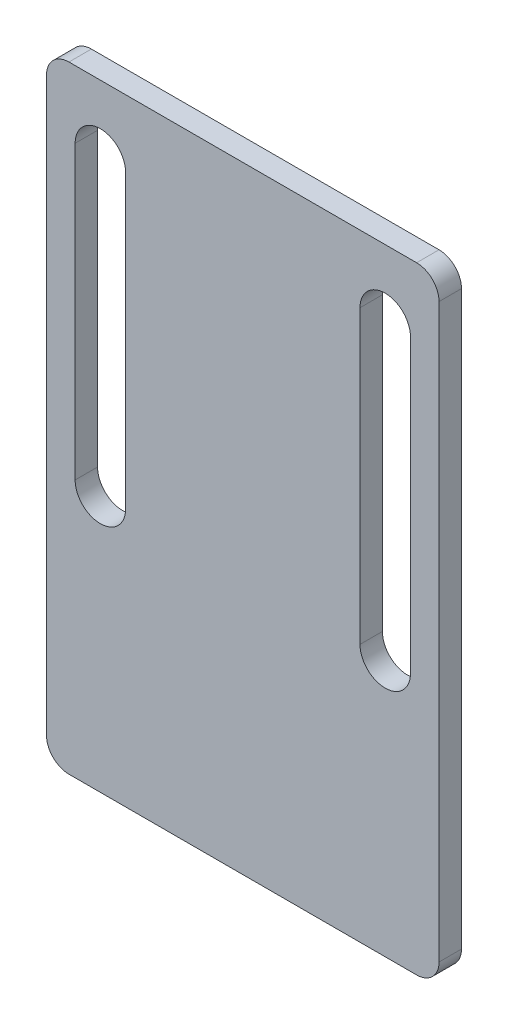
from build123d import *

# Parameters (mm, degrees)
SKETCH_1_W          = 35
SKETCH_1_H          = 55
EXTRUDE_1_DEPTH     = 2
CUT_EXTRUDE_1_DEPTH = 10
FILLET_1_R          = 2


with BuildPart() as part:
    # Sketch 1 → 凸台-拉伸1 (new body)
    with BuildSketch(Plane.XY):
        Rectangle(SKETCH_1_W, SKETCH_1_H)
    extrude(amount=EXTRUDE_1_DEPTH)

    # 草图9 → 切除-拉伸1 (cut)
    with BuildSketch(Plane.XY.offset(2)):
        with BuildLine():
            Line((14.95, 21.5), (14.95, -4.5))
            ThreePointArc((14.95, -4.5), (12.7, -6.75), (10.45, -4.5))
            Line((10.45, -4.5), (10.45, 21.5))
            ThreePointArc((10.45, 21.5), (12.7, 23.75), (14.95, 21.5))
        make_face()
        with BuildLine():
            Line((-14.95, 21.5), (-14.95, -4.5))
            ThreePointArc((-14.95, -4.5), (-12.7, -6.75), (-10.45, -4.5))
            Line((-10.45, -4.5), (-10.45, 21.5))
            ThreePointArc((-10.45, 21.5), (-12.7, 23.75), (-14.95, 21.5))
        make_face()
    extrude(amount=-CUT_EXTRUDE_1_DEPTH, mode=Mode.SUBTRACT)

    # 圆角1
    fillet_1_edges = [part.edges().sort_by_distance(p)[0] for p in [
        (17.5, 27.5, 1),
        (17.5, -27.5, 1),
        (-17.5, -27.5, 1),
        (-17.5, 27.5, 1),
    ]]
    fillet(fillet_1_edges, radius=FILLET_1_R)


solid = part.part
